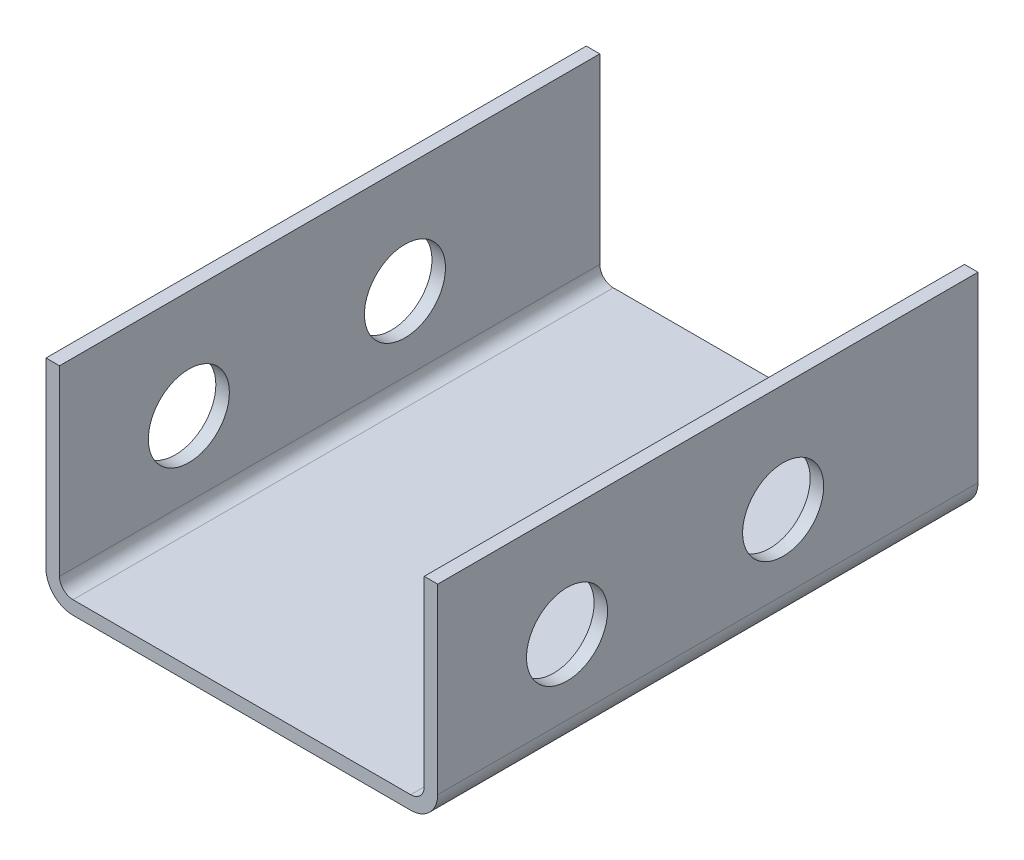
from build123d import *

# Parameters (mm, degrees)
BRIDA_BASE1_DEPTH     = 46
CROQUIS6_R            = 1.5
CROQUIS6_W            = 7.787282345
CROQUIS6_H            = 7.75
CROQUIS6_W_2          = 18.212717655
CORTAR_EXTRUIR2_DEPTH = 51.10004851


# Sheet-metal steps are written as plain solids
with BuildPart() as part:
    # Croquis1 → Brida base1 (new body)
    with BuildSketch(Plane.XY):
        with BuildLine():
            Line((-38.506869712, -5.805989848), (-38.506869712, -12.555989848))
            ThreePointArc((-38.506869712, -12.555989848), (-38.213976494, -13.263096629), (-37.506869712, -13.555989848))
            Line((-37.506869712, -13.555989848), (-25.006869712, -13.555989848))
            ThreePointArc((-25.006869712, -13.555989848), (-24.299762931, -13.263096629), (-24.006869712, -12.555989848))
            Line((-24.006869712, -12.555989848), (-24.006869712, -5.805989848))
            Line((-24.006869712, -5.805989848), (-24.506869712, -5.805989848))
            Line((-24.506869712, -5.805989848), (-24.506869712, -12.555989848))
            ThreePointArc((-24.506869712, -12.555989848), (-24.653316322, -12.909543238), (-25.006869712, -13.055989848))
            Line((-25.006869712, -13.055989848), (-37.506869712, -13.055989848))
            ThreePointArc((-37.506869712, -13.055989848), (-37.860423103, -12.909543238), (-38.006869712, -12.555989848))
            Line((-38.006869712, -12.555989848), (-38.006869712, -5.805989848))
            Line((-38.006869712, -5.805989848), (-38.506869712, -5.805989848))
        make_face()
    extrude(amount=BRIDA_BASE1_DEPTH)

    # Croquis6 → Cortar-Extruir2 (cut, through all)
    with BuildSketch(Plane(origin=(-24.006869712, 0, 0), x_dir=(0, 0, -1), z_dir=(1, 0, 0))):
        with Locations((-23, -9.805989848)):
            Circle(CROQUIS6_R)
        with Locations((-15, -9.805989848)):
            Circle(CROQUIS6_R)
        with Locations((-3.893641173, -9.680989848)):
            Rectangle(CROQUIS6_W, CROQUIS6_H)
        with Locations((-36.893641172, -9.680989848)):
            Rectangle(CROQUIS6_W_2, CROQUIS6_H)
    extrude(amount=-CORTAR_EXTRUIR2_DEPTH, mode=Mode.SUBTRACT)


solid = part.part
